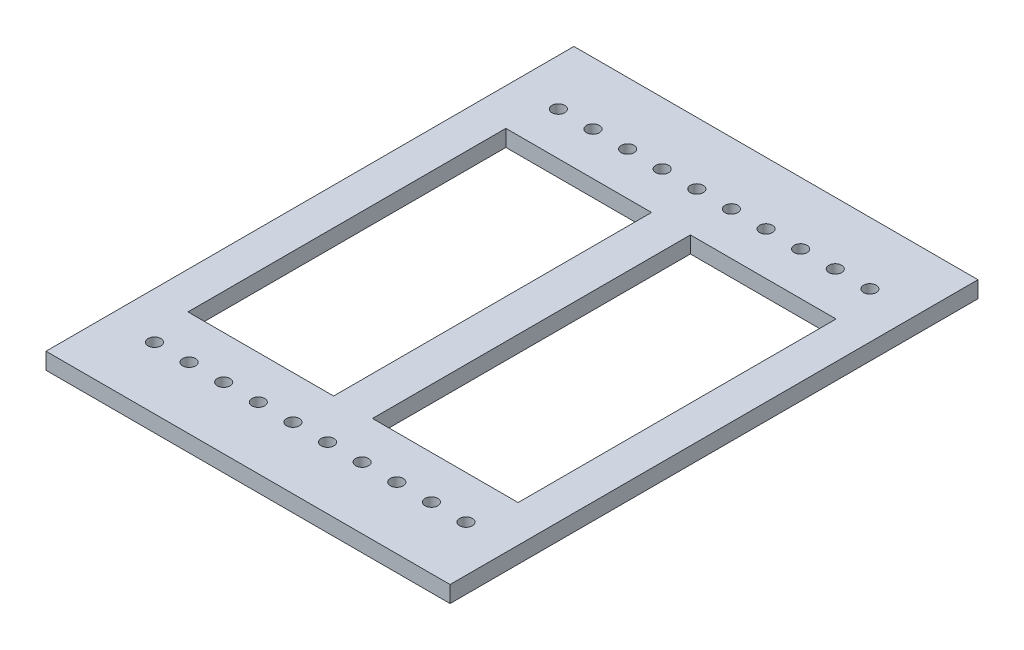
from build123d import *

# Parameters (mm, degrees)
SKETCH1_W           = 20.78
SKETCH1_H           = 27.15
SKETCH1_R           = 0.33
SKETCH1_W_2         = 7.49
SKETCH1_H_2         = 16.35
BOSS_EXTRUDE1_DEPTH = 0.85


with BuildPart() as part:
    # Sketch1 → Boss-Extrude1 (new body)
    with BuildSketch(Plane(origin=(0, 0, 0), x_dir=(1, 0, 0), z_dir=(0, 1, 0))):
        with Locations((10.39, 13.575)):
            Rectangle(SKETCH1_W, SKETCH1_H)
        with Locations((2.389, 23.96)):
            Circle(SKETCH1_R, mode=Mode.SUBTRACT)
        with Locations((4.169, 23.96)):
            Circle(SKETCH1_R, mode=Mode.SUBTRACT)
        with Locations((5.949, 23.96)):
            Circle(SKETCH1_R, mode=Mode.SUBTRACT)
        with Locations((7.729, 23.96)):
            Circle(SKETCH1_R, mode=Mode.SUBTRACT)
        with Locations((9.509, 23.96)):
            Circle(SKETCH1_R, mode=Mode.SUBTRACT)
        with Locations((11.289, 23.96)):
            Circle(SKETCH1_R, mode=Mode.SUBTRACT)
        with Locations((13.069, 23.96)):
            Circle(SKETCH1_R, mode=Mode.SUBTRACT)
        with Locations((14.849, 23.96)):
            Circle(SKETCH1_R, mode=Mode.SUBTRACT)
        with Locations((16.629, 23.96)):
            Circle(SKETCH1_R, mode=Mode.SUBTRACT)
        with Locations((18.409, 23.96)):
            Circle(SKETCH1_R, mode=Mode.SUBTRACT)
        with Locations((18.409, 3.19)):
            Circle(SKETCH1_R, mode=Mode.SUBTRACT)
        with Locations((16.629, 3.19)):
            Circle(SKETCH1_R, mode=Mode.SUBTRACT)
        with Locations((14.849, 3.19)):
            Circle(SKETCH1_R, mode=Mode.SUBTRACT)
        with Locations((13.069, 3.19)):
            Circle(SKETCH1_R, mode=Mode.SUBTRACT)
        with Locations((11.289, 3.19)):
            Circle(SKETCH1_R, mode=Mode.SUBTRACT)
        with Locations((9.509, 3.19)):
            Circle(SKETCH1_R, mode=Mode.SUBTRACT)
        with Locations((7.729, 3.19)):
            Circle(SKETCH1_R, mode=Mode.SUBTRACT)
        with Locations((5.949, 3.19)):
            Circle(SKETCH1_R, mode=Mode.SUBTRACT)
        with Locations((4.169, 3.19)):
            Circle(SKETCH1_R, mode=Mode.SUBTRACT)
        with Locations((2.389, 3.19)):
            Circle(SKETCH1_R, mode=Mode.SUBTRACT)
        with Locations((15.135, 13.575)):
            Rectangle(SKETCH1_W_2, SKETCH1_H_2, mode=Mode.SUBTRACT)
        with Locations((5.645, 13.575)):
            Rectangle(SKETCH1_W_2, SKETCH1_H_2, mode=Mode.SUBTRACT)
    extrude(amount=BOSS_EXTRUDE1_DEPTH)


solid = part.part
